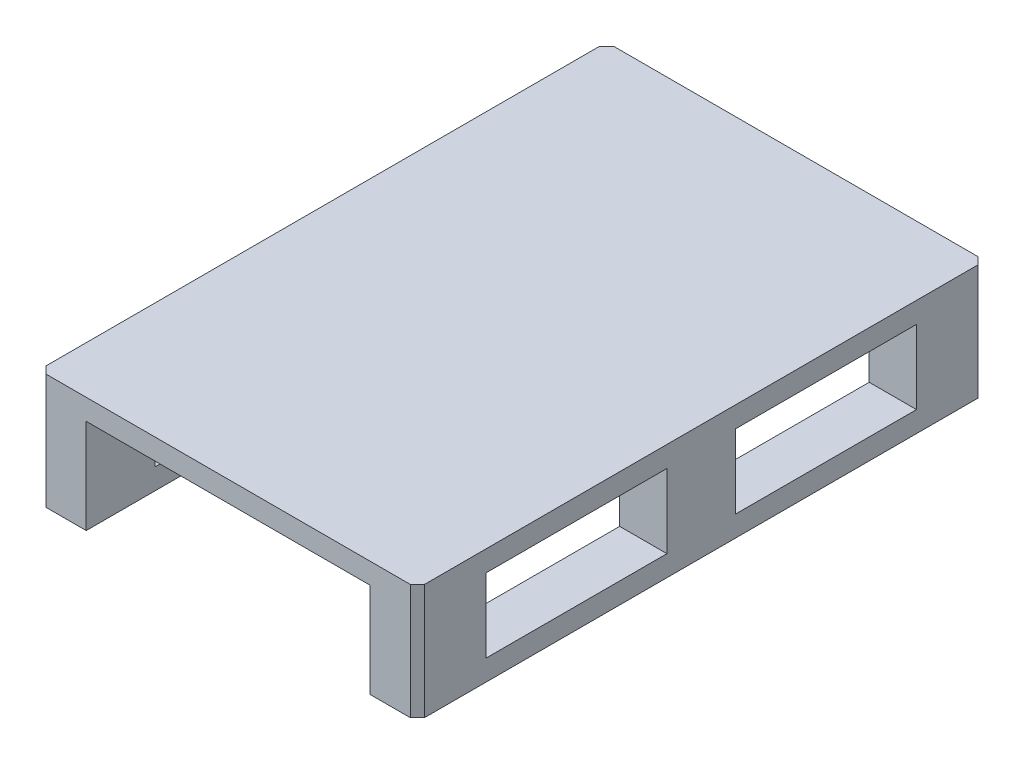
from build123d import *

# Parameters (mm, degrees)
SCHIZZO1_W                        = 60
SCHIZZO1_H                        = 7.2
SCHIZZO1_W_2                      = 19.125
SCHIZZO1_H_2                      = 5
ESTRUSIONE_ESTRUSIONE1_DEPTH      = 40
SCHIZZO2_W                        = 11.375
SCHIZZO2_H                        = 5
SCHIZZO2_W_2                      = 2.075
SCHIZZO2_H_2                      = 1.1
SCHIZZO2_W_3                      = 2.05
TAGLIO_ESTRUSIONE1_DEPTH          = 73.469579825
SMUSSO1_SIZE                      = 0.75
SCHIZZO3_W                        = 7.25
SCHIZZO3_H                        = 5
TAGLIO_ESTRUSIONE2_DEPTH          = 64
SCHIZZO4_W                        = 38.5
SCHIZZO4_H                        = 1.1
ESTRUSIONE_ESTRUSIONE3_DEPTH      = 60
SCHIZZO7_W                        = 30
SCHIZZO7_H                        = 1.1
ESTRUSIONE_ESTRUSIONE4_DEPTH      = 50
ESTRUSIONE_ESTRUSIONE5_DEPTH      = 5
ESTRUSIONE_ESTRUSIONE6_DEPTH      = 5
ESTRUSIONE_ESTRUSIONE6_DEPTH_BACK = 35
SCHIZZO9_W                        = 19.125
SCHIZZO9_H                        = 1.1
SCHIZZO10_W                       = 19.125
SCHIZZO10_H                       = 3.9
TAGLIO_ESTRUSIONE3_DEPTH          = 73.469579825


with BuildPart() as part:
    # Schizzo1 → Estrusione-Estrusione1 (new body)
    with BuildSketch(Plane(origin=(0, 0, 0), x_dir=(0, 0, -1), z_dir=(1, 0, 0))):
        with Locations((30, 3.6)):
            Rectangle(SCHIZZO1_W, SCHIZZO1_H)
        with Locations((43.1875, 3.6)):
            Rectangle(SCHIZZO1_W_2, SCHIZZO1_H_2, mode=Mode.SUBTRACT)
        with Locations((16.8125, 3.6)):
            Rectangle(SCHIZZO1_W_2, SCHIZZO1_H_2, mode=Mode.SUBTRACT)
    extrude(amount=ESTRUSIONE_ESTRUSIONE1_DEPTH)

    # Schizzo2 → Taglio-Estrusione1 (cut, through all)
    with BuildSketch(Plane.XY):
        with Locations((10.6875, 2.5)):
            Rectangle(SCHIZZO2_W, SCHIZZO2_H)
        with Locations((29.3125, 2.5)):
            Rectangle(SCHIZZO2_W, SCHIZZO2_H)
        with Locations((15.3375, 6.65)):
            Rectangle(SCHIZZO2_W_2, SCHIZZO2_H_2)
        with Locations((8.275, 6.65)):
            Rectangle(SCHIZZO2_W_3, SCHIZZO2_H_2)
        with Locations((24.6625, 6.65)):
            Rectangle(SCHIZZO2_W_2, SCHIZZO2_H_2)
        with Locations((31.725, 6.65)):
            Rectangle(SCHIZZO2_W_3, SCHIZZO2_H_2)
    extrude(amount=-TAGLIO_ESTRUSIONE1_DEPTH, mode=Mode.SUBTRACT)

    # Smusso1
    smusso1_edges = [part.edges().sort_by_distance(p)[0] for p in [
        (0, 3.6, -60),
        (40, 3.6, -60),
        (40, 3.6, 0),
        (0, 3.6, 0),
    ]]
    chamfer(smusso1_edges, length=SMUSSO1_SIZE)

    # Schizzo3 → Taglio-Estrusione2 (cut)
    with BuildSketch(Plane.XY):
        with Locations((20, 2.5)):
            Rectangle(SCHIZZO3_W, SCHIZZO3_H)
    extrude(amount=-TAGLIO_ESTRUSIONE2_DEPTH, mode=Mode.SUBTRACT)

    # Schizzo4 → Estrusione-Estrusione3 (add)
    with BuildSketch(Plane.XY):
        with Locations((20, 6.65)):
            Rectangle(SCHIZZO4_W, SCHIZZO4_H)
    extrude(amount=-ESTRUSIONE_ESTRUSIONE3_DEPTH)

    # Schizzo7 → Estrusione-Estrusione4 (add)
    with BuildSketch(Plane.XY.offset(-52.75)):
        with Locations((20, 5.55)):
            Rectangle(SCHIZZO7_W, SCHIZZO7_H)
    extrude(amount=ESTRUSIONE_ESTRUSIONE4_DEPTH)

    # Schizzo8 → Estrusione-Estrusione5 (add)
    with BuildSketch(Plane.XZ):
        Polygon((5, 0), (0.75, 0), (0, -0.75), (0, -59.25), (0.75, -60), (5, -60), align=None)
        Polygon((35, 0), (35, -60), (39.25, -60), (40, -59.25), (40, -0.75), (39.25, 0), align=None)
    extrude(amount=ESTRUSIONE_ESTRUSIONE5_DEPTH)

    # Schizzo9 → Estrusione-Estrusione6 (add, two sides: drawn at the far end of the back side and taken through both)
    with BuildSketch(Plane(origin=(35, 0, 0), x_dir=(0, 0, -1), z_dir=(1, 0, 0)).offset(-ESTRUSIONE_ESTRUSIONE6_DEPTH_BACK)):
        with Locations((16.8125, 5.55)):
            Rectangle(SCHIZZO9_W, SCHIZZO9_H)
        with Locations((43.1875, 5.55)):
            Rectangle(SCHIZZO9_W, SCHIZZO9_H)
    extrude(amount=ESTRUSIONE_ESTRUSIONE6_DEPTH + ESTRUSIONE_ESTRUSIONE6_DEPTH_BACK)

    # Schizzo10 → Taglio-Estrusione3 (cut, through all)
    with BuildSketch(Plane.ZY):
        with Locations((-43.1875, -0.85)):
            Rectangle(SCHIZZO10_W, SCHIZZO10_H)
        with Locations((-16.8125, -0.85)):
            Rectangle(SCHIZZO10_W, SCHIZZO10_H)
    extrude(amount=-TAGLIO_ESTRUSIONE3_DEPTH, mode=Mode.SUBTRACT)


solid = part.part
